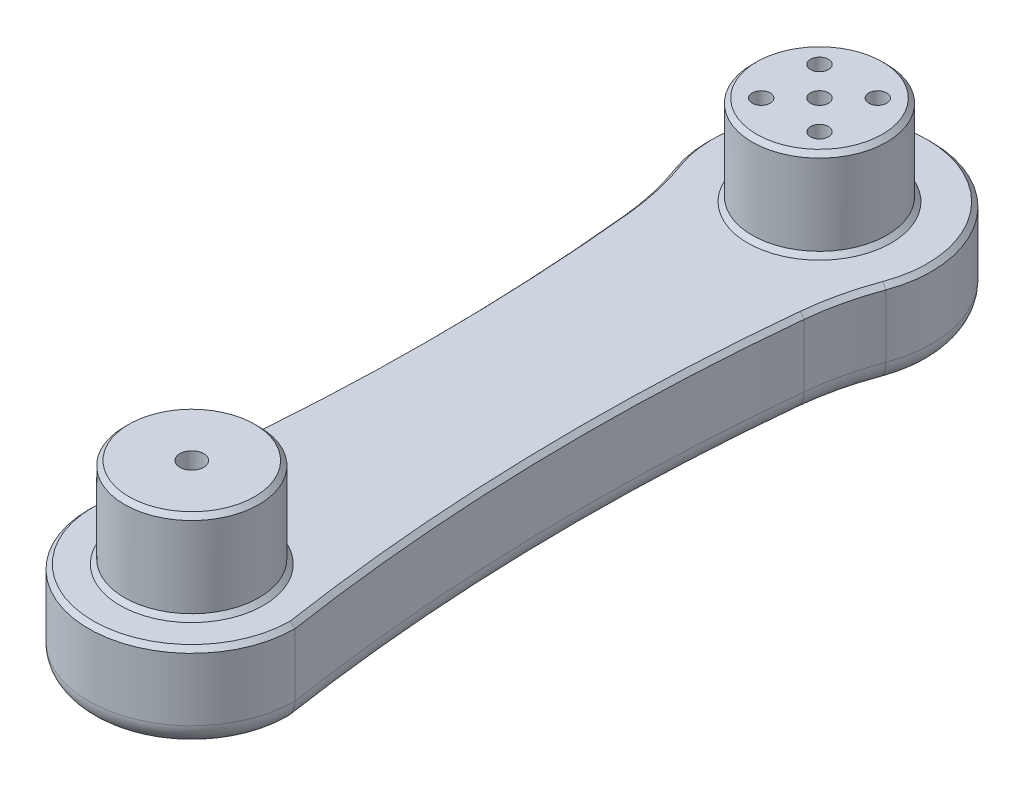
from build123d import *

# Parameters (mm, degrees)
BOSS_EXTRUDE1_DEPTH = 20
SKETCH2_R           = 15.01
BOSS_EXTRUDE2_DEPTH = 20
CHAMFER1_SIZE       = 1
CHAMFER3_SIZE       = 1
SKETCH5_R           = 2.65
CUT_EXTRUDE2_DEPTH  = 40
FILLET3_R           = 5
SKETCH6_R           = 3.65
CUT_EXTRUDE3_DEPTH  = 8
CHAMFER4_SIZE       = 0.5
SKETCH10_R          = 15.01
BOSS_EXTRUDE5_DEPTH = 20
CHAMFER5_SIZE       = 1
SKETCH11_R          = 2.0099999999999967
CUT_EXTRUDE5_DEPTH  = 40
SKETCH12_R          = 2.0000000000000018
SKETCH12_R_2        = 2.000000000000005
SKETCH12_R_3        = 1.9999999999999967
CUT_EXTRUDE6_DEPTH  = 19.999999999999996


with BuildPart() as part:
    # Sketch1 → Boss-Extrude1 (new body)
    with BuildSketch(Plane(origin=(0, 0, 0), x_dir=(1, 0, 0), z_dir=(0, 1, 0))):
        with BuildLine():
            ThreePointArc((-23, 0), (1.41e-15, -22.999999999999982), (23, 0))
            ThreePointArc((23, 0), (17.845208734768505, 58.18386045047181), (20.033890701411753, 116.55459936267802))
            ThreePointArc((20.033890701411753, 116.55459936267802), (21.27316153822275, 124.05347023326534), (23.45051159720983, 131.33550314045155))
            ThreePointArc((23.45051159720983, 131.33550314045155), (-2.067e-14, 165.00000000000006), (-23.45051159720983, 131.3355031404515))
            ThreePointArc((-23.45051159720983, 131.3355031404515), (-21.27316153822273, 124.05347023326526), (-20.033890701411725, 116.55459936267786))
            ThreePointArc((-20.033890701411725, 116.55459936267786), (-17.845208734768505, 58.1838604504716), (-23, 0))
        make_face()
    extrude(amount=BOSS_EXTRUDE1_DEPTH)

    # Sketch2 → Boss-Extrude2 (add)
    with BuildSketch(Plane(origin=(0, 20, 0), x_dir=(1, 0, 0), z_dir=(0, 1, 0))):
        with Locations(Location((0, 0, 0), (0, 0, 90))):
            Circle(SKETCH2_R)
    extrude(amount=BOSS_EXTRUDE2_DEPTH)

    # Chamfer1
    chamfer1_edges = [part.edges().sort_by_distance(p)[0] for p in [
        (-2.76e-15, 40, 15.01),
    ]]
    chamfer(chamfer1_edges, length=CHAMFER1_SIZE)

    # Chamfer3
    # the kernel refuses this chamfer: 1 mm, written as the material it adds along each edge
    with BuildSketch(Plane(origin=(0, 20, 0), x_dir=(6e-17, 0, -1), z_dir=(1, 0, 6e-17))) as chamfer3_piece_1:
        Polygon((15.01, CHAMFER3_SIZE), (15.01 + CHAMFER3_SIZE, 0), (15.01, 0), align=None)
    revolve(axis=Axis((0, 20, 0), (0, 1, 0)))
    # the kernel refuses this chamfer: 1 mm, written as the material it takes off along each edge
    with BuildSketch(Plane(origin=(-79.73173943051358, 20, -110.54071067753486), x_dir=(0.9380204638883933, 0, -0.3465798743819428), z_dir=(-0.3465798743819428, 0, -0.9380204638883933))) as chamfer3_2_piece_1:
        Polygon((60.00000000000017 + CHAMFER3_SIZE, 0), (60.00000000000017, CHAMFER3_SIZE), (60.00000000000017, 0), align=None)
    revolve(axis=Axis((-79.73173943051358, 20, -110.54071067753486), (0, -1, 0)), revolution_arc=14.525766875036835, mode=Mode.SUBTRACT)
    with BuildSketch(Plane(origin=(-482.16572850262514, 20, -70.00000000000004), x_dir=(0.9949641454850282, 0, -0.1002314780857173), z_dir=(-0.1002314780857173, 0, -0.9949641454850282))) as chamfer3_2_piece_2:
        Polygon((464.4708454051196 + CHAMFER3_SIZE, 0), (464.4708454051196, CHAMFER3_SIZE), (464.4708454051196, 0), align=None)
    revolve(axis=Axis((-482.16572850262514, 20, -70.00000000000004), (0, -1, 0)), revolution_arc=14.737763084908373, mode=Mode.SUBTRACT)
    with BuildSketch(Plane(origin=(0, 20, -1.599e-14), x_dir=(-0.9937354343699007, 0, -0.11175816067592001), z_dir=(0.11175816067592001, 0, -0.9937354343699007))) as chamfer3_2_piece_3:
        Polygon((23.000000000000004 - CHAMFER3_SIZE, 0), (23.000000000000004, -CHAMFER3_SIZE), (23.000000000000004, 0), align=None)
    revolve(axis=Axis((0, 20, -1.599e-14), (0, 1, 0)), revolution_arc=192.83335153216495, mode=Mode.SUBTRACT)
    with BuildSketch(Plane(origin=(482.16572850261997, 20, -69.99999999999986), x_dir=(-0.9877285445231084, 0, 0.15618041597544133), z_dir=(0.15618041597544133, 0, 0.9877285445231084))) as chamfer3_2_piece_4:
        Polygon((464.4708454051149 + CHAMFER3_SIZE, 0), (464.47084540511446, CHAMFER3_SIZE), (464.4708454051149, 0), align=None)
    revolve(axis=Axis((482.16572850261997, 20, -69.99999999999986), (0, -1, 0)), revolution_arc=14.737763084908554, mode=Mode.SUBTRACT)
    with BuildSketch(Plane(origin=(79.7317394305139, 20, -110.54071067753493), x_dir=(-0.9949641454850281, 0, -0.10023147808571735), z_dir=(-0.10023147808571735, 0, 0.9949641454850281))) as chamfer3_2_piece_5:
        Polygon((60.000000000000455 + CHAMFER3_SIZE, 0), (60.000000000000455, CHAMFER3_SIZE), (60.000000000000455, 0), align=None)
    revolve(axis=Axis((79.7317394305139, 20, -110.54071067753493), (0, -1, 0)), revolution_arc=14.525766875036666, mode=Mode.SUBTRACT)
    with BuildSketch(Plane(origin=(9.77e-15, 20, -140.00000000000006), x_dir=(0.9380204638883942, 0, 0.3465798743819405), z_dir=(-0.3465798743819405, 0, 0.9380204638883942))) as chamfer3_2_piece_6:
        Polygon((24.999999999999982 - CHAMFER3_SIZE, 0), (24.999999999999982, -CHAMFER3_SIZE), (24.999999999999982, 0), align=None)
    revolve(axis=Axis((9.77e-15, 20, -140.00000000000006), (0, 1, 0)), revolution_arc=220.55653408148345, mode=Mode.SUBTRACT)

    # Sketch5 → Cut-Extrude2 (cut)
    with BuildSketch(Plane(origin=(0, 40, 0), x_dir=(1, 0, 0), z_dir=(0, 1, 0))):
        with Locations(Location((0, 0, 0), (0, 0, 270))):
            Circle(SKETCH5_R)
    extrude(amount=-CUT_EXTRUDE2_DEPTH, mode=Mode.SUBTRACT)

    # Fillet3
    # the kernel refuses this fillet: 5 mm, written as the material it takes off along each edge
    with BuildSketch(Plane(origin=(482.16572850261997, 0, -69.99999999999986), x_dir=(-0.9868985080370148, 0, 0.1613422909045059), z_dir=(0.1613422909045059, 0, 0.9868985080370148))) as fillet3_piece_1:
        with BuildLine():
            CenterArc((464.4708454051144 + FILLET3_R, -FILLET3_R), FILLET3_R, 89.99999999999935, 90.00000000000068)
            Line((464.4708454051144 + FILLET3_R, 8.9e-16), (464.4708454051144 + FILLET3_R, FILLET3_R * 0.02))
            Line((464.4708454051144 + FILLET3_R, FILLET3_R * 0.02), (464.4708454051144 - FILLET3_R * 0.02, FILLET3_R * 0.02))
            Line((464.4708454051144 - FILLET3_R * 0.02, FILLET3_R * 0.02), (464.4708454051144 - FILLET3_R * 0.02, -FILLET3_R))
            Line((464.4708454051144 - FILLET3_R * 0.02, -FILLET3_R), (464.4708454051144, -FILLET3_R))
        make_face()
    revolve(axis=Axis((482.16572850261997, 0, -69.99999999999986), (0, -1, 0)), revolution_arc=15.03731633345655, mode=Mode.SUBTRACT)
    with BuildSketch(Plane(origin=(0, 0, -1.599e-14), x_dir=(-0.9763879588864252, 0, -0.21602442857603077), z_dir=(0.21602442857603077, 0, -0.9763879588864252))) as fillet3_piece_2:
        with BuildLine():
            CenterArc((23 - FILLET3_R, FILLET3_R), FILLET3_R, 269.99999999999994, 90.00000000000006)
            Line((23 - FILLET3_R, -8.9e-16), (23 - FILLET3_R, -FILLET3_R * 0.02))
            Line((23 - FILLET3_R, -FILLET3_R * 0.02), (23 + FILLET3_R * 0.02, -FILLET3_R * 0.02))
            Line((23 + FILLET3_R * 0.02, -FILLET3_R * 0.02), (23 + FILLET3_R * 0.02, FILLET3_R))
            Line((23 + FILLET3_R * 0.02, FILLET3_R), (23.000000000000004, FILLET3_R))
        make_face()
    revolve(axis=Axis((0, 0, -1.599e-14), (0, 1, 0)), revolution_arc=204.95127041750123, mode=Mode.SUBTRACT)
    with BuildSketch(Plane(origin=(-482.16572850262514, 0, -70.00000000000004), x_dir=(0.9949641454850282, 0, -0.1002314780857173), z_dir=(-0.1002314780857173, 0, -0.9949641454850282))) as fillet3_piece_3:
        with BuildLine():
            CenterArc((464.4708454051196 + FILLET3_R, -FILLET3_R), FILLET3_R, 90, 90)
            Line((464.4708454051196 + FILLET3_R, 8.9e-16), (464.4708454051196 + FILLET3_R, FILLET3_R * 0.02))
            Line((464.4708454051196 + FILLET3_R, FILLET3_R * 0.02), (464.4708454051196 - FILLET3_R * 0.02, FILLET3_R * 0.02))
            Line((464.4708454051196 - FILLET3_R * 0.02, FILLET3_R * 0.02), (464.4708454051196 - FILLET3_R * 0.02, -FILLET3_R))
            Line((464.4708454051196 - FILLET3_R * 0.02, -FILLET3_R), (464.4708454051196, -FILLET3_R))
        make_face()
    revolve(axis=Axis((-482.16572850262514, 0, -70.00000000000004), (0, -1, 0)), revolution_arc=15.037316333456364, mode=Mode.SUBTRACT)
    with BuildSketch(Plane(origin=(-79.73173943051358, 0, -110.54071067753486), x_dir=(0.9380204638883933, 0, -0.3465798743819428), z_dir=(-0.3465798743819428, 0, -0.9380204638883933))) as fillet3_piece_4:
        with BuildLine():
            CenterArc((60.00000000000017 + FILLET3_R, -FILLET3_R), FILLET3_R, 90, 90)
            Line((60.00000000000017 + FILLET3_R, 8.9e-16), (60.00000000000017 + FILLET3_R, FILLET3_R * 0.02))
            Line((60.00000000000017 + FILLET3_R, FILLET3_R * 0.02), (60.00000000000017 - FILLET3_R * 0.02, FILLET3_R * 0.02))
            Line((60.00000000000017 - FILLET3_R * 0.02, FILLET3_R * 0.02), (60.00000000000017 - FILLET3_R * 0.02, -FILLET3_R))
            Line((60.00000000000017 - FILLET3_R * 0.02, -FILLET3_R), (60.00000000000018, -FILLET3_R))
        make_face()
    revolve(axis=Axis((-79.73173943051358, 0, -110.54071067753486), (0, -1, 0)), revolution_arc=14.525766875036835, mode=Mode.SUBTRACT)
    with BuildSketch(Plane(origin=(9.77e-15, 0, -140.00000000000006), x_dir=(0.9380204638883942, 0, 0.3465798743819405), z_dir=(-0.3465798743819405, 0, 0.9380204638883942))) as fillet3_piece_5:
        with BuildLine():
            CenterArc((24.999999999999982 - FILLET3_R, FILLET3_R), FILLET3_R, 270, 90)
            Line((24.999999999999982 - FILLET3_R, -8.9e-16), (24.999999999999982 - FILLET3_R, -FILLET3_R * 0.02))
            Line((24.999999999999982 - FILLET3_R, -FILLET3_R * 0.02), (24.999999999999982 + FILLET3_R * 0.02, -FILLET3_R * 0.02))
            Line((24.999999999999982 + FILLET3_R * 0.02, -FILLET3_R * 0.02), (24.999999999999982 + FILLET3_R * 0.02, FILLET3_R))
            Line((24.999999999999982 + FILLET3_R * 0.02, FILLET3_R), (24.999999999999986, FILLET3_R))
        make_face()
    revolve(axis=Axis((9.77e-15, 0, -140.00000000000006), (0, 1, 0)), revolution_arc=220.55653408148345, mode=Mode.SUBTRACT)
    with BuildSketch(Plane(origin=(79.7317394305139, 0, -110.54071067753493), x_dir=(-0.9949641454850281, 0, -0.10023147808571735), z_dir=(-0.10023147808571735, 0, 0.9949641454850281))) as fillet3_piece_6:
        with BuildLine():
            CenterArc((60.000000000000455 + FILLET3_R, -FILLET3_R), FILLET3_R, 90, 90)
            Line((60.000000000000455 + FILLET3_R, 8.9e-16), (60.000000000000455 + FILLET3_R, FILLET3_R * 0.02))
            Line((60.000000000000455 + FILLET3_R, FILLET3_R * 0.02), (60.000000000000455 - FILLET3_R * 0.02, FILLET3_R * 0.02))
            Line((60.000000000000455 - FILLET3_R * 0.02, FILLET3_R * 0.02), (60.000000000000455 - FILLET3_R * 0.02, -FILLET3_R))
            Line((60.000000000000455 - FILLET3_R * 0.02, -FILLET3_R), (60.000000000000455, -FILLET3_R))
        make_face()
    revolve(axis=Axis((79.7317394305139, 0, -110.54071067753493), (0, -1, 0)), revolution_arc=14.525766875036666, mode=Mode.SUBTRACT)

    # Sketch6 → Cut-Extrude3 (cut)
    with BuildSketch(Plane.XZ):
        with Locations(Location((0, 0, 0), (0, 0, 270))):
            Circle(SKETCH6_R)
    extrude(amount=-CUT_EXTRUDE3_DEPTH, mode=Mode.SUBTRACT)

    # Chamfer4
    chamfer4_edges = [part.edges().sort_by_distance(p)[0] for p in [
        (1.12e-15, 0, 3.65),
    ]]
    chamfer(chamfer4_edges, length=CHAMFER4_SIZE)

    # Sketch10 → Boss-Extrude5 (add)
    with BuildSketch(Plane(origin=(0, 20, 0), x_dir=(1, 0, 0), z_dir=(0, 1, 0))):
        with Locations(Location((0, 140.00000000000009, 0), (0, 0, 90))):
            Circle(SKETCH10_R)
    extrude(amount=BOSS_EXTRUDE5_DEPTH)

    # Chamfer5
    chamfer5_edges = [part.edges().sort_by_distance(p)[0] for p in [
        (-2.76e-15, 20, -124.99000000000008),
        (-2.76e-15, 40, -124.99000000000008),
    ]]
    chamfer(chamfer5_edges, length=CHAMFER5_SIZE)

    # Sketch11 → Cut-Extrude5 (cut)
    with BuildSketch(Plane(origin=(0, 40, 0), x_dir=(1, 0, 0), z_dir=(0, 1, 0))):
        with Locations(Location((0, 140.00000000000009, 0), (0, 0, 270))):
            Circle(SKETCH11_R)
    extrude(amount=-CUT_EXTRUDE5_DEPTH, mode=Mode.SUBTRACT)

    # Sketch12 → Cut-Extrude6 (cut)
    with BuildSketch(Plane(origin=(0, 40, 0), x_dir=(1, 0, 0), z_dir=(0, 1, 0))):
        with Locations(Location((-6.500000000000021, 146.50000000000014, 0), (0, 0, 270))):
            Circle(SKETCH12_R)
        with Locations(Location((-6.4999999999999885, 133.5000000000001, 0), (0, 0, 270))):
            Circle(SKETCH12_R)
        with Locations(Location((6.500000000000011, 133.50000000000009, 0), (0, 0, 90))):
            Circle(SKETCH12_R_2)
        with Locations(Location((6.499999999999978, 146.5000000000001, 0), (0, 0, 90))):
            Circle(SKETCH12_R_3)
    extrude(amount=-CUT_EXTRUDE6_DEPTH, mode=Mode.SUBTRACT)


solid = part.part
